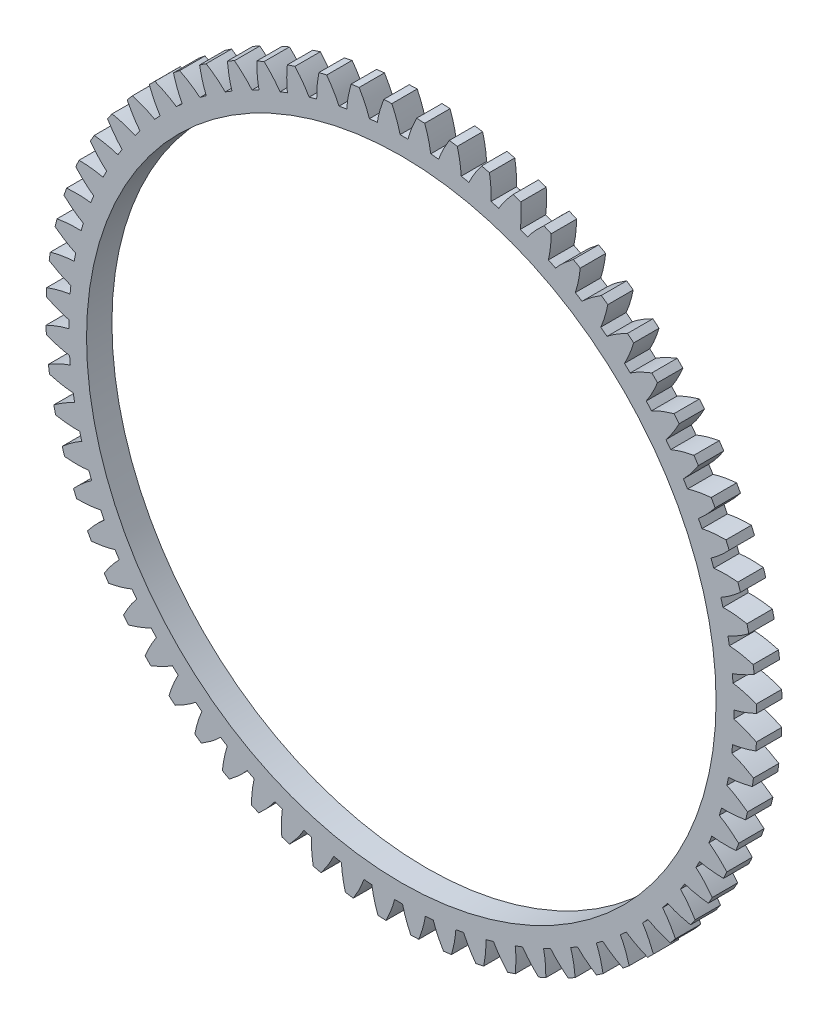
from build123d import *

# Parameters (mm, degrees)
SKETCH_1_R               = 32.75
SKETCH_1_R_2             = 31
EXTRUDE_1_DEPTH          = 2.5
EXTRUDE_2_DEPTH          = 2.5
PATTERN_CIRCULAR_1_COUNT = 68


with BuildPart() as part:
    # 草图1 → 凸台-拉伸1 (new body)
    with BuildSketch(Plane.XY):
        Circle(SKETCH_1_R)
        Circle(SKETCH_1_R_2, mode=Mode.SUBTRACT)
    extrude(amount=EXTRUDE_1_DEPTH)

    # 草图2 → 凸台-拉伸2 (add)
    with BuildSketch(Plane.XY):
        with BuildLine():
            ThreePointArc((34.957446863, 1.725372079), (34.974727283, 1.329831372), (34.987532335, 0.934120499))
            add(Edge.make_bspline(
                [(34.987532335, 0.934120499), (34.657627823, 0.775919302), (34.157365099, 0.558854411), (33.477256936, 0.318606194), (32.806141046, 0.121521601), (32.294184895, 0.019604312), (31.949549107, 0)],
                knots=[0, 0, 0, 0, 0.343517704, 0.511474253, 0.676892777, 1, 1, 1, 1], degree=3))
            ThreePointArc((31.949549107, 0), (31.926479052, 1.213928935), (31.857302205, 2.426104768))
            add(Edge.make_bspline(
                [(34.957446863, 1.725372079), (34.616481788, 1.858065045), (34.101180527, 2.036515515), (33.404792651, 2.224425723), (32.720648737, 2.369979764), (32.202431601, 2.432727147), (31.857302205, 2.426104768)],
                knots=[0, 0, 0, 0, 0.343517704, 0.511474253, 0.676892777, 1, 1, 1, 1], degree=3))
        make_face()
    extrude_2 = extrude(amount=EXTRUDE_2_DEPTH)

    # 阵列(圆周)1: 凸台-拉伸2 ×68 about axis
    pattern_circular_1_axis = Axis((0, 0, 2.5), (0, 0, -1))
    for i in range(1, PATTERN_CIRCULAR_1_COUNT):
        add(extrude_2.rotate(pattern_circular_1_axis, i * 360 / PATTERN_CIRCULAR_1_COUNT))


solid = part.part
